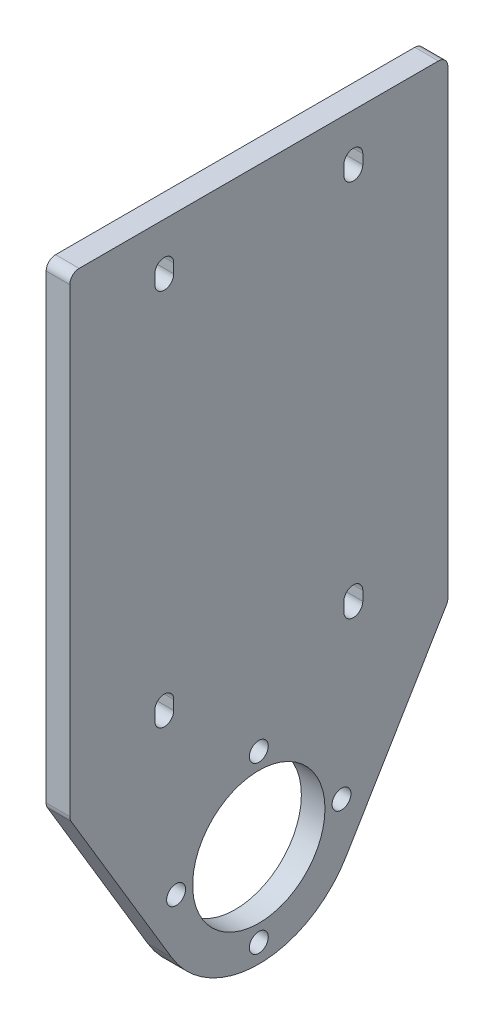
from build123d import *

# Parameters (mm, degrees)
SKETCH1_R           = 2
SKETCH1_R_2         = 14
BOSS_EXTRUDE1_DEPTH = 5
FILLET1_R           = 2


with BuildPart() as part:
    # Sketch1 → Boss-Extrude1 (new body)
    with BuildSketch(Plane(origin=(0, 0, 0), x_dir=(0, 0, -1), z_dir=(1, 0, 0))):
        with BuildLine():
            Line((40, 50), (-40, 50))
            Line((-40, 50), (-40, -50))
            Line((-40, -50), (-18.452584301, -86.034134882))
            ThreePointArc((-18.452584301, -86.034134882), (0, -96.5), (18.452584301, -86.034134882))
            Line((18.452584301, -86.034134882), (40, -50))
            Line((40, -50), (40, 50))
        make_face()
        with BuildLine():
            Line((-18, -39), (-18, -41))
            ThreePointArc((-18, -41), (-20, -43), (-22, -41))
            Line((-22, -41), (-22, -39))
            ThreePointArc((-22, -39), (-20, -37), (-18, -39))
        make_face(mode=Mode.SUBTRACT)
        with BuildLine():
            ThreePointArc((22, -41), (20, -43), (18, -41))
            Line((18, -41), (18, -39))
            ThreePointArc((18, -39), (20, -37), (22, -39))
            Line((22, -39), (22, -41))
        make_face(mode=Mode.SUBTRACT)
        with BuildLine():
            ThreePointArc((-22, 41), (-20, 43), (-18, 41))
            Line((-18, 41), (-18, 39))
            ThreePointArc((-18, 39), (-20, 37), (-22, 39))
            Line((-22, 39), (-22, 41))
        make_face(mode=Mode.SUBTRACT)
        with BuildLine():
            Line((18, 39), (18, 41))
            ThreePointArc((18, 41), (20, 43), (22, 41))
            Line((22, 41), (22, 39))
            ThreePointArc((22, 39), (20, 37), (18, 39))
        make_face(mode=Mode.SUBTRACT)
        with Locations((17.5, -75)):
            Circle(SKETCH1_R, mode=Mode.SUBTRACT)
        with Locations((0, -57.5)):
            Circle(SKETCH1_R, mode=Mode.SUBTRACT)
        with Locations((-17.5, -75)):
            Circle(SKETCH1_R, mode=Mode.SUBTRACT)
        with Locations((0, -92.5)):
            Circle(SKETCH1_R, mode=Mode.SUBTRACT)
        with Locations((0, -75)):
            Circle(SKETCH1_R_2, mode=Mode.SUBTRACT)
    extrude(amount=BOSS_EXTRUDE1_DEPTH)

    # Fillet1
    fillet1_edges = [part.edges().sort_by_distance(p)[0] for p in [
        (2.5, -50, -40),
        (2.5, -50, 40),
        (2.5, 50, -40),
        (2.5, 50, 40),
    ]]
    fillet(fillet1_edges, radius=FILLET1_R)


solid = part.part
